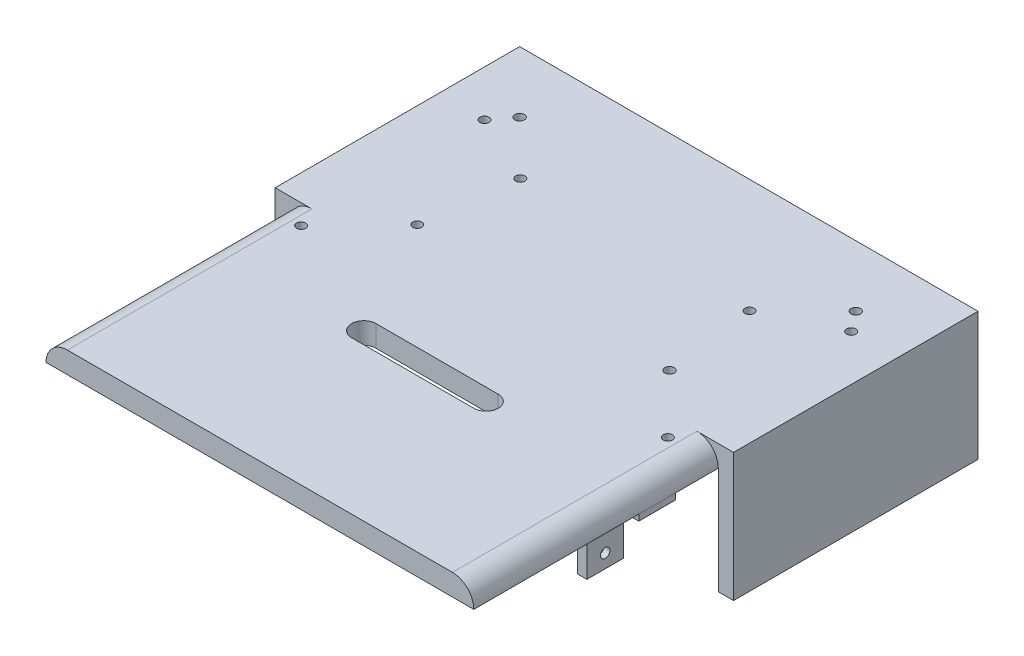
from build123d import *

# Parameters (mm, degrees)
BOSS_EXTRUDE1_DEPTH = 160
CUT_EXTRUDE1_DEPTH  = 32
SKETCH3_R           = 7.5
CUT_EXTRUDE2_DEPTH  = 210
SKETCH5_R           = 1.5
CUT_EXTRUDE4_DEPTH  = 210
CUT_EXTRUDE6_DEPTH  = 20
SKETCH8_R           = 1.55
CUT_EXTRUDE7_DEPTH  = 10
SKETCH9_W           = 20
SKETCH9_H           = 12
BOSS_EXTRUDE3_DEPTH = 2
SKETCH10_W          = 3
SKETCH10_H          = 12
BOSS_EXTRUDE4_DEPTH = 25
SKETCH11_R          = 3.5
CUT_EXTRUDE8_DEPTH  = 1
SKETCH12_R          = 1.55
CUT_EXTRUDE9_DEPTH  = 3
SKETCH13_R          = 1.5
SKETCH13_R_2        = 1.55
CUT_EXTRUDE10_DEPTH = 10
SKETCH14_R          = 1.375
BOSS_EXTRUDE5_DEPTH = 5
SKETCH15_W          = 80
SKETCH15_H          = 42
CUT_EXTRUDE11_DEPTH = 5
FILLET1_R           = 7
SKETCH16_W          = 80
SKETCH16_H          = 42
CUT_EXTRUDE12_DEPTH = 5
FILLET2_R           = 7


with BuildPart() as part:
    # Sketch1 → Boss-Extrude1 (new body)
    with BuildSketch(Plane.XY):
        Polygon((-95.061728395, -14.551440329), (-95.061728395, 27.448559671), (54.938271605, 27.448559671), (54.938271605, -14.551440329), (49.938271605, -14.551440329), (49.938271605, 20.448559671), (-90.061728395, 20.448559671), (-90.061728395, -14.551440329), align=None)
    extrude(amount=BOSS_EXTRUDE1_DEPTH)

    # Sketch2 → Cut-Extrude1 (cut)
    with BuildSketch(Plane(origin=(0, 0, 0), x_dir=(-1, 0, 0), z_dir=(0, 0, -1))):
        with BuildLine():
            Line((-50.938271605, 15.448559671), (-50.938271605, -4.551440329))
            ThreePointArc((-50.938271605, -4.551440329), (-52.438271605, -6.051440329), (-53.938271605, -4.551440329))
            Line((-53.938271605, -4.551440329), (-53.938271605, 15.448559671))
            ThreePointArc((-53.938271605, 15.448559671), (-52.438271605, 16.948559671), (-50.938271605, 15.448559671))
        make_face()
        with BuildLine():
            Line((-4.938271605, 25.448559671), (45.061728395, 25.448559671))
            ThreePointArc((45.061728395, 25.448559671), (46.561728395, 23.948559671), (45.061728395, 22.448559671))
            Line((45.061728395, 22.448559671), (-4.938271605, 22.448559671))
            ThreePointArc((-4.938271605, 22.448559671), (-6.438271605, 23.948559671), (-4.938271605, 25.448559671))
        make_face()
        with BuildLine():
            Line((94.061728395, 15.448559671), (94.061728395, -4.551440329))
            ThreePointArc((94.061728395, -4.551440329), (92.561728395, -6.051440329), (91.061728395, -4.551440329))
            Line((91.061728395, -4.551440329), (91.061728395, 15.448559671))
            ThreePointArc((91.061728395, 15.448559671), (92.561728395, 16.948559671), (94.061728395, 15.448559671))
        make_face()
    extrude(amount=-CUT_EXTRUDE1_DEPTH, mode=Mode.SUBTRACT)

    # Sketch3 → Cut-Extrude2 (cut)
    with BuildSketch(Plane.ZY.offset(95.061728395)):
        with Locations((120, 7.448559671)):
            Circle(SKETCH3_R)
    extrude(amount=-CUT_EXTRUDE2_DEPTH, mode=Mode.SUBTRACT)

    # Sketch5 → Cut-Extrude4 (cut)
    with BuildSketch(Plane(origin=(0, 27.448559671, 0), x_dir=(1, 0, 0), z_dir=(0, 1, 0))):
        with Locations(Location((-80.061728395, -26.5, 0), (0, 0, 180))):
            Circle(SKETCH5_R)
        with Locations(Location((39.938271605, -26.5, 0), (0, 0, 180))):
            Circle(SKETCH5_R)
        with Locations(Location((-80.061728395, -86.5, 0), (0, 0, 180))):
            Circle(SKETCH5_R)
        with Locations(Location((39.938271605, -86.5, 0), (0, 0, 180))):
            Circle(SKETCH5_R)
    extrude(amount=-CUT_EXTRUDE4_DEPTH, mode=Mode.SUBTRACT)

    # Sketch7 → Cut-Extrude6 (cut)
    with BuildSketch(Plane(origin=(0, 27.448559671, 0), x_dir=(1, 0, 0), z_dir=(0, 1, 0))):
        with BuildLine():
            Line((-40.061728395, -102), (-0.061728395, -102))
            ThreePointArc((-0.061728395, -102), (3.938271605, -106), (-0.061728395, -110))
            Line((-0.061728395, -110), (-40.061728395, -110))
            ThreePointArc((-40.061728395, -110), (-44.061728395, -106), (-40.061728395, -102))
        make_face()
    extrude(amount=-CUT_EXTRUDE6_DEPTH, mode=Mode.SUBTRACT)

    # Sketch8 → Cut-Extrude7 (cut)
    with BuildSketch(Plane(origin=(0, 27.448559671, 0), x_dir=(1, 0, 0), z_dir=(0, 1, 0))):
        with Locations(Location((-75.061728395, -20, 0), (0, 0, 180))):
            Circle(SKETCH8_R)
        with Locations(Location((34.938271605, -20, 0), (0, 0, 180))):
            Circle(SKETCH8_R)
    extrude(amount=-CUT_EXTRUDE7_DEPTH, mode=Mode.SUBTRACT)

    # Sketch9 → Boss-Extrude3 (add)
    with BuildSketch(Plane.XZ.offset(-20.448559671)):
        with Locations((39.938271605, 100)):
            Rectangle(SKETCH9_W, SKETCH9_H)
    boss_extrude3 = extrude(amount=BOSS_EXTRUDE3_DEPTH)

    # Sketch10 → Boss-Extrude4 (add)
    with BuildSketch(Plane.XZ.offset(-18.448559671)):
        with Locations((31.438271605, 100)):
            Rectangle(SKETCH10_W, SKETCH10_H)
    boss_extrude4 = extrude(amount=BOSS_EXTRUDE4_DEPTH)

    # Sketch11 → Cut-Extrude8 (cut)
    with BuildSketch(Plane.ZY.offset(-29.938271605)):
        with Locations(Location((100, 15.948559671, 0), (0, 0, 270))):
            Circle(SKETCH11_R)
        with Locations(Location((100, -2.051440329, 0), (0, 0, 270))):
            Circle(SKETCH11_R)
    cut_extrude8 = extrude(amount=-CUT_EXTRUDE8_DEPTH, mode=Mode.SUBTRACT)

    # Sketch12 → Cut-Extrude9 (cut)
    with BuildSketch(Plane.ZY.offset(-30.938271605)):
        with Locations(Location((100, 15.948559671, 0), (0, 0, 270))):
            Circle(SKETCH12_R)
        with Locations(Location((100, -2.051440329, 0), (0, 0, 270))):
            Circle(SKETCH12_R)
    cut_extrude9 = extrude(amount=-CUT_EXTRUDE9_DEPTH, mode=Mode.SUBTRACT)

    # Mirror1: Boss-Extrude3, Boss-Extrude4, Cut-Extrude8, Cut-Extrude9 across plane
    add(boss_extrude3.mirror(Plane.ZY.offset(20.061728395)))
    add(boss_extrude4.mirror(Plane.ZY.offset(20.061728395)))
    add(cut_extrude8.mirror(Plane.ZY.offset(20.061728395)), mode=Mode.SUBTRACT)
    add(cut_extrude9.mirror(Plane.ZY.offset(20.061728395)), mode=Mode.SUBTRACT)

    # Sketch13 → Cut-Extrude10 (cut)
    with BuildSketch(Plane(origin=(0, 27.448559671, 0), x_dir=(1, 0, 0), z_dir=(0, 1, 0))):
        with Locations(Location((17.438271605, -37.265826534, 0), (0, 0, 180))):
            Circle(SKETCH13_R)
        with Locations(Location((-57.561728395, -37.265826534, 0), (0, 0, 180))):
            Circle(SKETCH13_R)
        with Locations(Location((-61.341728395, -67.223803809, 0), (0, 0, 180))):
            Circle(SKETCH13_R)
        with Locations(Location((21.218271605, -67.223803809, 0), (0, 0, 180))):
            Circle(SKETCH13_R_2)
    extrude(amount=-CUT_EXTRUDE10_DEPTH, mode=Mode.SUBTRACT)

    # Sketch14 → Boss-Extrude5 (add)
    # profile 1 of 2: a face of its own
    with BuildSketch(Plane.XZ.offset(-20.448559671)):
        with BuildLine():
            Line((5.139369782, 81.650400065), (5.139369782, 56.650400065))
            ThreePointArc((5.139369782, 56.650400065), (2.139369782, 53.650400065), (-0.860630218, 56.650400065))
            Line((-0.860630218, 56.650400065), (-0.860630218, 81.650400065))
            ThreePointArc((-0.860630218, 81.650400065), (2.139369782, 84.650400065), (5.139369782, 81.650400065))
        make_face()
        with Locations((2.139369782, 69.150400065)):
            Circle(SKETCH14_R, mode=Mode.SUBTRACT)
    # profile 2 of 2: a face of its own
    with BuildSketch(Plane.XZ.offset(-20.448559671)):
        with BuildLine():
            Line((-36.860630218, 81.650400065), (-36.860630218, 56.650400065))
            ThreePointArc((-36.860630218, 56.650400065), (-39.860630218, 53.650400065), (-42.860630218, 56.650400065))
            Line((-42.860630218, 56.650400065), (-42.860630218, 81.650400065))
            ThreePointArc((-42.860630218, 81.650400065), (-39.860630218, 84.650400065), (-36.860630218, 81.650400065))
        make_face()
        with Locations((-39.860630218, 69.150400065)):
            Circle(SKETCH14_R, mode=Mode.SUBTRACT)
    extrude(amount=BOSS_EXTRUDE5_DEPTH)

    # Sketch15 → Cut-Extrude11 (cut)
    with BuildSketch(Plane(origin=(54.938271605, 0, 0), x_dir=(0, 0, -1), z_dir=(1, 0, 0))):
        with Locations((-120, 6.448559671)):
            Rectangle(SKETCH15_W, SKETCH15_H)
    extrude(amount=-CUT_EXTRUDE11_DEPTH, mode=Mode.SUBTRACT)

    # Fillet1
    fillet1_edges = [part.edges().sort_by_distance(p)[0] for p in [
        (49.938271605, 27.448559671, 120),
    ]]
    fillet(fillet1_edges, radius=FILLET1_R - 0.0001)  # a hair under: the kernel refuses the full size

    # Sketch16 → Cut-Extrude12 (cut)
    with BuildSketch(Plane.ZY.offset(95.061728395)):
        with Locations((120, 6.448559671)):
            Rectangle(SKETCH16_W, SKETCH16_H)
    extrude(amount=-CUT_EXTRUDE12_DEPTH, mode=Mode.SUBTRACT)

    # Fillet2
    fillet2_edges = [part.edges().sort_by_distance(p)[0] for p in [
        (-90.061728395, 27.448559671, 120),
    ]]
    fillet(fillet2_edges, radius=FILLET2_R - 0.0001)  # a hair under: the kernel refuses the full size


solid = part.part
